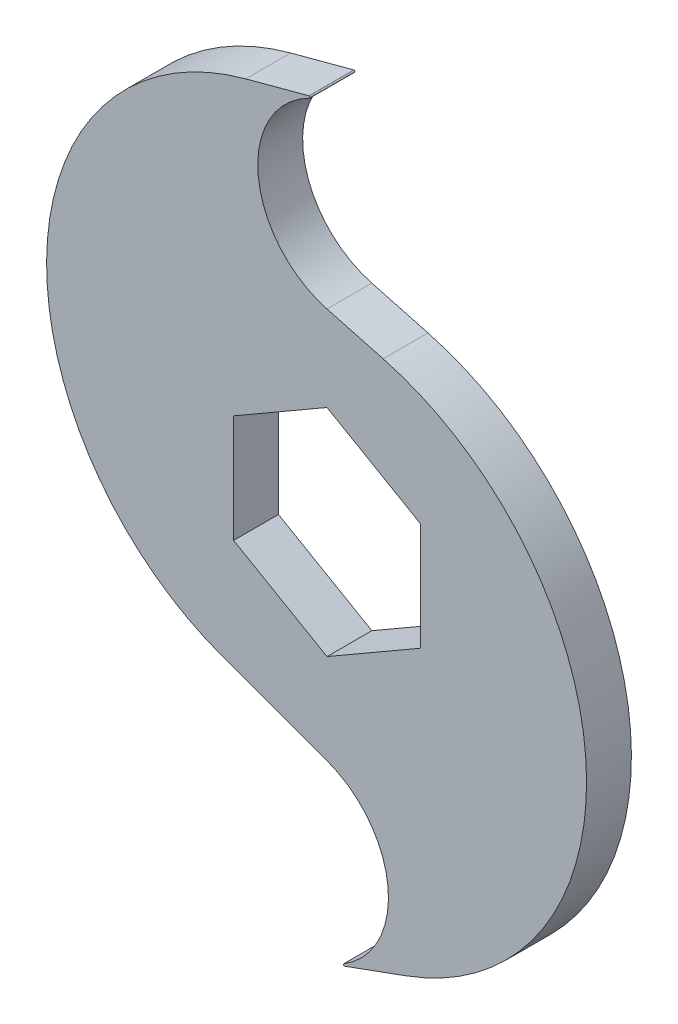
from build123d import *

# Parameters (mm, degrees)
BOSS_EXTRUDE1_DEPTH = 3.048
FILLET1_R           = 0.127


with BuildPart() as part:
    # Sketch1 → Boss-Extrude1 (new, symmetric)
    with BuildSketch(Plane.XY):
        with BuildLine():
            Line((0, 50.8), (-11.040532194, 47.841698314))
            ThreePointArc((-11.040532194, 47.841698314), (-38.095102898, 14.132401849), (-14.081441775, -21.80658177))
            Line((-14.081441775, -21.80658177), (0, -26.931807432))
            ThreePointArc((0, -26.931807432), (8.35634418, -38.865903716), (0, -50.8))
            Line((0, -50.8), (10.740686656, -46.890709762))
            ThreePointArc((10.740686656, -46.890709762), (35.258377113, -10.197392936), (7.635950588, 24.219437219))
            Line((7.635950588, 24.219437219), (0, 26.265484012))
            ThreePointArc((0, 26.265484012), (-9.412998127, 38.532742006), (0, 50.8))
        make_face()
        Polygon((0, 14.664696837), (-12.7, 7.332348419), (-12.7, -7.332348419), (0, -14.664696837), (12.7, -7.332348419), (12.7, 7.332348419), align=None, mode=Mode.SUBTRACT)
    extrude(amount=BOSS_EXTRUDE1_DEPTH, both=True)

    # Fillet1
    fillet1_edges = [part.edges().sort_by_distance(p)[0] for p in [
        (0, 50.8, 0),
        (0, -50.8, 0),
    ]]
    fillet(fillet1_edges, radius=FILLET1_R)


solid = part.part
